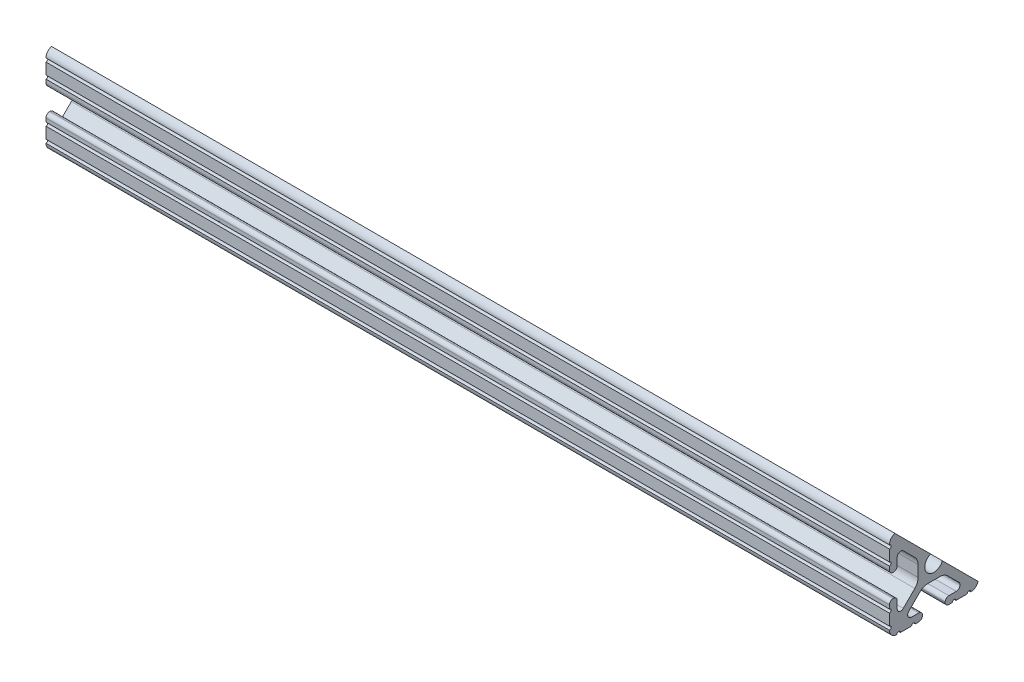
from build123d import *

# Parameters (mm, degrees)
SKETCH1_R           = 2.6035
BOSS_EXTRUDE1_DEPTH = 241.3
CUT_EXTRUDE1_START  = -241.3
CUT_EXTRUDE1_DEPTH  = 241.3


# Read off the part's stored shape, not the designer's step: Cut-Extrude1
with BuildPart() as part:
    # Sketch1 → Boss-Extrude1 (new body)
    with BuildSketch(Plane(origin=(0, 0, 0), x_dir=(0, 0, -1), z_dir=(1, 0, 0))):
        with BuildLine():
            Line((6.333126718, -12.7), (9.550443118, -12.7))
            ThreePointArc((9.550443118, -12.7), (10.058366869, -12.192000006), (10.566443095, -12.699847501))
            ThreePointArc((10.566443095, -12.699847501), (12.082537762, -12.08250727), (12.699846982, -10.566399977))
            ThreePointArc((12.699846982, -10.566399977), (12.192000006, -10.058323491), (12.7, -9.5504))
            Line((12.7, -9.5504), (12.7, -6.3330836))
            ThreePointArc((12.7, -6.3330836), (12.192, -5.8250836), (12.7, -5.3170836))
            Line((12.7, -5.3170836), (12.7, -4.287469289))
            ThreePointArc((12.7, -4.287469289), (12.39275138, -3.545705502), (11.650987593, -3.238456882))
            Line((11.650987593, -3.238456882), (11.539212407, -3.238456882))
            ThreePointArc((11.539212407, -3.238456882), (10.79744862, -3.545705502), (10.4902, -4.287469289))
            Line((10.4902, -4.287469289), (10.4902, -6.402089023))
            ThreePointArc((10.4902, -6.402089023), (9.856505071, -7.351067942), (8.737131347, -7.129408934))
            Line((8.737131347, -7.129408934), (5.441005833, -3.840816462))
            ThreePointArc((5.441005833, -3.840816462), (4.750877967, -2.809883091), (4.5085, -1.593185507))
            Line((4.5085, -1.593185507), (4.5085, 1.593185507))
            ThreePointArc((4.5085, 1.593185507), (4.750877967, 2.809883091), (5.441005833, 3.840816462))
            Line((5.441005833, 3.840816462), (8.737131347, 7.129408934))
            ThreePointArc((8.737131347, 7.129408934), (9.856505071, 7.351067942), (10.4902, 6.402089023))
            Line((10.4902, 6.402089023), (10.4902, 4.287469289))
            ThreePointArc((10.4902, 4.287469289), (10.79744862, 3.545705502), (11.539212407, 3.238456882))
            Line((11.539212407, 3.238456882), (11.650987593, 3.238456882))
            ThreePointArc((11.650987593, 3.238456882), (12.39275138, 3.545705502), (12.7, 4.287469289))
            Line((12.7, 4.287469289), (12.7, 5.3170836))
            ThreePointArc((12.7, 5.3170836), (12.192, 5.8250836), (12.7, 6.3330836))
            Line((12.7, 6.3330836), (12.7, 9.5504))
            ThreePointArc((12.7, 9.5504), (12.192000006, 10.058323491), (12.699846982, 10.566399977))
            ThreePointArc((12.699846982, 10.566399977), (12.082537762, 12.08250727), (10.566443095, 12.699847501))
            ThreePointArc((10.566443095, 12.699847501), (10.058366869, 12.192000006), (9.550443118, 12.7))
            Line((9.550443118, 12.7), (6.333126718, 12.7))
            ThreePointArc((6.333126718, 12.7), (5.825126718, 12.192), (5.317126718, 12.7))
            Line((5.317126718, 12.7), (4.287512407, 12.7))
            ThreePointArc((4.287512407, 12.7), (3.54574862, 12.39275138), (3.2385, 11.650987593))
            Line((3.2385, 11.650987593), (3.2385, 11.539212407))
            ThreePointArc((3.2385, 11.539212407), (3.54574862, 10.79744862), (4.287512407, 10.4902))
            Line((4.287512407, 10.4902), (6.476788598, 10.4902))
            ThreePointArc((6.476788598, 10.4902), (7.432222385, 9.85140422), (7.207036008, 8.724370562))
            Line((7.207036008, 8.724370562), (3.898272566, 5.423169045))
            ThreePointArc((3.898272566, 5.423169045), (2.869120213, 4.736787962), (1.655778399, 4.4958))
            Line((1.655778399, 4.4958), (-1.655778399, 4.4958))
            ThreePointArc((-1.655778399, 4.4958), (-2.869120213, 4.736787962), (-3.898272566, 5.423169045))
            Line((-3.898272566, 5.423169045), (-7.207036008, 8.724370562))
            ThreePointArc((-7.207036008, 8.724370562), (-7.432222385, 9.85140422), (-6.476788598, 10.4902))
            Line((-6.476788598, 10.4902), (-4.287512407, 10.4902))
            ThreePointArc((-4.287512407, 10.4902), (-3.54574862, 10.79744862), (-3.2385, 11.539212407))
            Line((-3.2385, 11.539212407), (-3.2385, 11.650987593))
            ThreePointArc((-3.2385, 11.650987593), (-3.54574862, 12.39275138), (-4.287512407, 12.7))
            Line((-4.287512407, 12.7), (-5.317126718, 12.7))
            ThreePointArc((-5.317126718, 12.7), (-5.825126718, 12.192), (-6.333126718, 12.7))
            Line((-6.333126718, 12.7), (-9.550443118, 12.7))
            ThreePointArc((-9.550443118, 12.7), (-10.058366869, 12.192000006), (-10.566443095, 12.699847501))
            ThreePointArc((-10.566443095, 12.699847501), (-12.082537762, 12.08250727), (-12.699846982, 10.566399977))
            ThreePointArc((-12.699846982, 10.566399977), (-12.192000006, 10.058323491), (-12.7, 9.5504))
            Line((-12.7, 9.5504), (-12.7, 6.3330836))
            ThreePointArc((-12.7, 6.3330836), (-12.192, 5.8250836), (-12.7, 5.3170836))
            Line((-12.7, 5.3170836), (-12.7, 4.287469289))
            ThreePointArc((-12.7, 4.287469289), (-12.39275138, 3.545705502), (-11.650987593, 3.238456882))
            Line((-11.650987593, 3.238456882), (-11.539212407, 3.238456882))
            ThreePointArc((-11.539212407, 3.238456882), (-10.79744862, 3.545705502), (-10.4902, 4.287469289))
            Line((-10.4902, 4.287469289), (-10.4902, 6.402089023))
            ThreePointArc((-10.4902, 6.402089023), (-9.856505071, 7.351067942), (-8.737131347, 7.129408934))
            Line((-8.737131347, 7.129408934), (-5.441005833, 3.840816462))
            ThreePointArc((-5.441005833, 3.840816462), (-4.750877967, 2.809883091), (-4.5085, 1.593185507))
            Line((-4.5085, 1.593185507), (-4.5085, -1.593185507))
            ThreePointArc((-4.5085, -1.593185507), (-4.750877967, -2.809883091), (-5.441005833, -3.840816462))
            Line((-5.441005833, -3.840816462), (-8.737131347, -7.129408934))
            ThreePointArc((-8.737131347, -7.129408934), (-9.856505071, -7.351067942), (-10.4902, -6.402089023))
            Line((-10.4902, -6.402089023), (-10.4902, -4.287469289))
            ThreePointArc((-10.4902, -4.287469289), (-10.79744862, -3.545705502), (-11.539212407, -3.238456882))
            Line((-11.539212407, -3.238456882), (-11.650987593, -3.238456882))
            ThreePointArc((-11.650987593, -3.238456882), (-12.39275138, -3.545705502), (-12.7, -4.287469289))
            Line((-12.7, -4.287469289), (-12.7, -5.3170836))
            ThreePointArc((-12.7, -5.3170836), (-12.192, -5.8250836), (-12.7, -6.3330836))
            Line((-12.7, -6.3330836), (-12.7, -9.5504))
            ThreePointArc((-12.7, -9.5504), (-12.192000006, -10.058323491), (-12.699846982, -10.566399977))
            ThreePointArc((-12.699846982, -10.566399977), (-12.082537762, -12.08250727), (-10.566443095, -12.699847501))
            ThreePointArc((-10.566443095, -12.699847501), (-10.058366869, -12.192000006), (-9.550443118, -12.7))
            Line((-9.550443118, -12.7), (-6.333126718, -12.7))
            ThreePointArc((-6.333126718, -12.7), (-5.825126718, -12.192), (-5.317126718, -12.7))
            Line((-5.317126718, -12.7), (-4.287512407, -12.7))
            ThreePointArc((-4.287512407, -12.7), (-3.54574862, -12.39275138), (-3.2385, -11.650987593))
            Line((-3.2385, -11.650987593), (-3.2385, -11.539212407))
            ThreePointArc((-3.2385, -11.539212407), (-3.54574862, -10.79744862), (-4.287512407, -10.4902))
            Line((-4.287512407, -10.4902), (-6.416408329, -10.4902))
            ThreePointArc((-6.416408329, -10.4902), (-7.41473083, -9.822813117), (-7.179650497, -8.645192506))
            Line((-7.179650497, -8.645192506), (-3.952270251, -5.423690499))
            ThreePointArc((-3.952270251, -5.423690499), (-2.922936451, -4.736929036), (-1.709253557, -4.4958))
            Line((-1.709253557, -4.4958), (1.709253557, -4.4958))
            ThreePointArc((1.709253557, -4.4958), (2.922936451, -4.736929036), (3.952270251, -5.423690499))
            Line((3.952270251, -5.423690499), (7.179650497, -8.645192506))
            ThreePointArc((7.179650497, -8.645192506), (7.41473083, -9.822813117), (6.416408329, -10.4902))
            Line((6.416408329, -10.4902), (4.287512407, -10.4902))
            ThreePointArc((4.287512407, -10.4902), (3.54574862, -10.79744862), (3.2385, -11.539212407))
            Line((3.2385, -11.539212407), (3.2385, -11.650987593))
            ThreePointArc((3.2385, -11.650987593), (3.54574862, -12.39275138), (4.287512407, -12.7))
            Line((4.287512407, -12.7), (5.317126718, -12.7))
            ThreePointArc((5.317126718, -12.7), (5.825126718, -12.192), (6.333126718, -12.7))
        make_face()
        with Locations(Location((0, 0, 0), (0, 0, 180))):
            Circle(SKETCH1_R, mode=Mode.SUBTRACT)
    extrude(amount=BOSS_EXTRUDE1_DEPTH)

    # Cut-Extrude1 outline → Cut-Extrude1 (cut)
    with BuildSketch(Plane.ZY.offset(CUT_EXTRUDE1_START)):
        with BuildLine():
            ThreePointArc((-12.699846982, -10.566399977), (-12.684913132, -10.843563097), (-12.633696634, -11.11636208))
            Line((-12.633696634, -11.11636208), (-2.436025345, -0.918690791))
            ThreePointArc((-2.436025345, -0.918690791), (-1.840952505, 1.840952505), (0.918690791, 2.436025345))
            Line((0.918690791, 2.436025345), (7.207036008, 8.724370562))
            Line((7.207036008, 8.724370562), (3.898272566, 5.423169045))
            ThreePointArc((3.898272566, 5.423169045), (2.869120213, 4.736787962), (1.655778399, 4.4958))
            Line((1.655778399, 4.4958), (-1.655778399, 4.4958))
            ThreePointArc((-1.655778399, 4.4958), (-2.869120213, 4.736787962), (-3.898272566, 5.423169045))
            Line((-3.898272566, 5.423169045), (-7.207036008, 8.724370562))
            ThreePointArc((-7.207036008, 8.724370562), (-7.432222385, 9.85140422), (-6.476788598, 10.4902))
            Line((-6.476788598, 10.4902), (-4.287512407, 10.4902))
            ThreePointArc((-4.287512407, 10.4902), (-3.54574862, 10.79744862), (-3.2385, 11.539212407))
            Line((-3.2385, 11.539212407), (-3.2385, 11.650987593))
            ThreePointArc((-3.2385, 11.650987593), (-3.54574862, 12.39275138), (-4.287512407, 12.7))
            Line((-4.287512407, 12.7), (-5.317126718, 12.7))
            ThreePointArc((-5.317126718, 12.7), (-5.825126718, 12.192), (-6.333126718, 12.7))
            Line((-6.333126718, 12.7), (-9.550443118, 12.7))
            ThreePointArc((-9.550443118, 12.7), (-10.058366868, 12.192000006), (-10.566443095, 12.699847501))
            ThreePointArc((-10.566443095, 12.699847501), (-12.082537762, 12.08250727), (-12.699846982, 10.566399977))
            ThreePointArc((-12.699846982, 10.566399977), (-12.192000006, 10.058323491), (-12.7, 9.5504))
            Line((-12.7, 9.5504), (-12.7, 6.3330836))
            ThreePointArc((-12.7, 6.3330836), (-12.192, 5.8250836), (-12.7, 5.3170836))
            Line((-12.7, 5.3170836), (-12.7, 4.287469289))
            ThreePointArc((-12.7, 4.287469289), (-12.39275138, 3.545705502), (-11.650987593, 3.238456882))
            Line((-11.650987593, 3.238456882), (-11.539212407, 3.238456882))
            ThreePointArc((-11.539212407, 3.238456882), (-10.79744862, 3.545705502), (-10.4902, 4.287469289))
            Line((-10.4902, 4.287469289), (-10.4902, 6.402089023))
            ThreePointArc((-10.4902, 6.402089023), (-9.856505071, 7.351067942), (-8.737131347, 7.129408934))
            Line((-8.737131347, 7.129408934), (-5.441005833, 3.840816462))
            ThreePointArc((-5.441005833, 3.840816462), (-4.750877967, 2.80988309), (-4.5085, 1.593185507))
            Line((-4.5085, 1.593185507), (-4.5085, -1.593185507))
            ThreePointArc((-4.5085, -1.593185507), (-4.750877967, -2.80988309), (-5.441005833, -3.840816462))
            Line((-5.441005833, -3.840816462), (-8.737131347, -7.129408934))
            ThreePointArc((-8.737131347, -7.129408934), (-9.856505071, -7.351067942), (-10.4902, -6.402089023))
            Line((-10.4902, -6.402089023), (-10.4902, -4.287469289))
            ThreePointArc((-10.4902, -4.287469289), (-10.79744862, -3.545705502), (-11.539212407, -3.238456882))
            Line((-11.539212407, -3.238456882), (-11.650987593, -3.238456882))
            ThreePointArc((-11.650987593, -3.238456882), (-12.39275138, -3.545705502), (-12.7, -4.287469289))
            Line((-12.7, -4.287469289), (-12.7, -5.3170836))
            ThreePointArc((-12.7, -5.3170836), (-12.192, -5.8250836), (-12.7, -6.3330836))
            Line((-12.7, -6.3330836), (-12.7, -9.5504))
            ThreePointArc((-12.7, -9.5504), (-12.192000006, -10.058323491), (-12.699846982, -10.566399977))
        make_face()
        with BuildLine():
            ThreePointArc((6.476788598, 10.4902), (7.43199622, 9.851950672), (7.20787286, 8.725206458))
            Line((7.20787286, 8.725206458), (11.11636208, 12.633696634))
            ThreePointArc((11.11636208, 12.633696634), (10.843584503, 12.684910557), (10.566443095, 12.699847501))
            ThreePointArc((10.566443095, 12.699847501), (10.058366868, 12.192000006), (9.550443118, 12.7))
            Line((9.550443118, 12.7), (6.333126718, 12.7))
            ThreePointArc((6.333126718, 12.7), (5.825126718, 12.192), (5.317126718, 12.7))
            Line((5.317126718, 12.7), (4.287512407, 12.7))
            ThreePointArc((4.287512407, 12.7), (3.54574862, 12.39275138), (3.2385, 11.650987593))
            Line((3.2385, 11.650987593), (3.2385, 11.539212407))
            ThreePointArc((3.2385, 11.539212407), (3.54574862, 10.79744862), (4.287512407, 10.4902))
            Line((4.287512407, 10.4902), (6.476788598, 10.4902))
        make_face()
    extrude(amount=CUT_EXTRUDE1_DEPTH, mode=Mode.SUBTRACT)


solid = part.part
